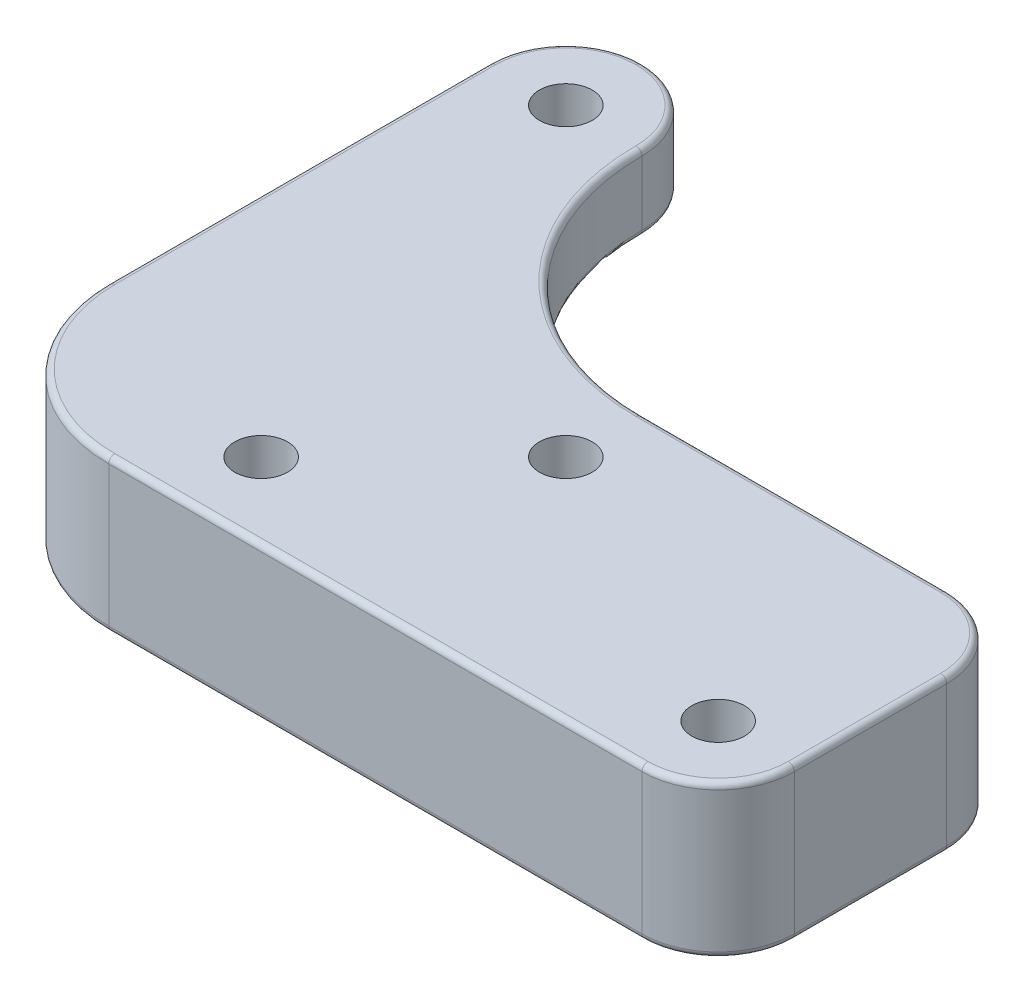
from build123d import *

# Parameters (mm, degrees)
SKETCH1_R           = 2.2
BOSS_EXTRUDE1_DEPTH = 6.35
FILLET3_R           = 19.05
FILLET4_R           = 6.35
FILLET5_R           = 6.35
FILLET10_R          = 12.7
SKETCH3_R           = 2.2
BOSS_EXTRUDE3_DEPTH = 6.35
FILLET6_R           = 12.7
FILLET8_R           = 3.175
FILLET9_R           = 0.5


with BuildPart() as part:
    # Sketch1 → Boss-Extrude1 (new body)
    with BuildSketch(Plane(origin=(0, 0, 0), x_dir=(1, 0, 0), z_dir=(0, 1, 0))):
        Polygon((63.5, -25.4), (12.7, -25.4), (12.7, 0), (0, 0), (0, -50.8), (63.5, -50.8), align=None)
        with Locations(Location((6.35, -6.35, 0), (0, 0, 270))):
            Circle(SKETCH1_R, mode=Mode.SUBTRACT)
        with Locations(Location((31.75, -31.75, 0), (0, 0, 270))):
            Circle(SKETCH1_R, mode=Mode.SUBTRACT)
        with Locations(Location((57.15, -44.45, 0), (0, 0, 270))):
            Circle(SKETCH1_R, mode=Mode.SUBTRACT)
        with Locations(Location((19.05, -44.45, 0), (0, 0, 270))):
            Circle(SKETCH1_R, mode=Mode.SUBTRACT)
    extrude(amount=BOSS_EXTRUDE1_DEPTH)

    # Fillet3
    fillet3_edges = [part.edges().sort_by_distance(p)[0] for p in [
        (12.7, 3.175, 25.4),
    ]]
    fillet(fillet3_edges, radius=FILLET3_R)

    # Fillet4
    fillet4_edges = [part.edges().sort_by_distance(p)[0] for p in [
        (0, 3.175, 0),
        (12.7, 3.175, 0),
    ]]
    fillet(fillet4_edges, radius=FILLET4_R - 0.0001)  # a hair under: the kernel refuses the full size

    # Fillet5
    fillet5_edges = [part.edges().sort_by_distance(p)[0] for p in [
        (63.5, 3.175, 25.4),
        (63.5, 3.175, 50.8),
    ]]
    fillet(fillet5_edges, radius=FILLET5_R)

    # Fillet10
    fillet10_edges = [part.edges().sort_by_distance(p)[0] for p in [
        (0, 3.175, 50.8),
    ]]
    fillet(fillet10_edges, radius=FILLET10_R)

    # Sketch3 → Boss-Extrude3 (add)
    with BuildSketch(Plane.XZ):
        with BuildLine():
            Line((0, 25.4), (31.75, 25.4))
            Line((31.75, 25.4), (57.15, 25.4))
            ThreePointArc((57.15, 25.4), (61.640128061, 27.259871939), (63.5, 31.75))
            Line((63.5, 31.75), (63.5, 44.45))
            ThreePointArc((63.5, 44.45), (61.640128061, 48.940128061), (57.15, 50.8))
            Line((57.15, 50.8), (12.7, 50.8))
            ThreePointArc((12.7, 50.8), (3.719743879, 47.080256121), (0, 38.1))
            Line((0, 38.1), (0, 25.4))
        make_face()
        with Locations(Location((19.05, 44.45, 0), (0, 0, 270))):
            Circle(SKETCH3_R, mode=Mode.SUBTRACT)
        with Locations(Location((31.75, 31.75, 0), (0, 0, 270))):
            Circle(SKETCH3_R, mode=Mode.SUBTRACT)
        with Locations(Location((57.15, 44.45, 0), (0, 0, 270))):
            Circle(SKETCH3_R, mode=Mode.SUBTRACT)
    extrude(amount=BOSS_EXTRUDE3_DEPTH)

    # Fillet6
    fillet6_edges = [part.edges().sort_by_distance(p)[0] for p in [
        (0, -3.175, 25.4),
    ]]
    fillet(fillet6_edges, radius=FILLET6_R - 0.0001)  # a hair under: the kernel refuses the full size

    # Fillet8
    fillet8_edges = [part.edges().sort_by_distance(p)[0] for p in [
        (22.22495, 0, 25.4),
    ]]
    fillet(fillet8_edges, radius=FILLET8_R)

    # Fillet9
    fillet9_edges = [part.edges().sort_by_distance(p)[0] for p in [
        (3.71971459, -6.35, 29.11971459),
        (18.279615818, 6.35, 19.820384182),
        (0, 0, 17.462416667),
        (1.85984265, 0, 1.85984265),
        (10.84015735, 0, 1.85984265),
        (0, 6.35, 22.22495),
        (1.85984265, 6.35, 1.85984265),
        (10.84015735, 6.35, 1.85984265),
        (63.5, 6.35, 38.1),
        (44.45, 6.35, 25.4),
        (61.640128061, 6.35, 27.259871939),
        (61.640128061, 6.35, 48.940128061),
        (34.925, 6.35, 50.8),
        (3.719743879, 6.35, 47.080256121),
        (34.92495, -6.35, 25.4),
        (61.640128061, -6.35, 27.259871939),
        (63.5, -6.35, 38.1),
        (61.640128061, -6.35, 48.940128061),
        (34.925, -6.35, 50.8),
        (3.719743879, -6.35, 47.080256121),
    ]]
    fillet(fillet9_edges, radius=FILLET9_R)


solid = part.part
